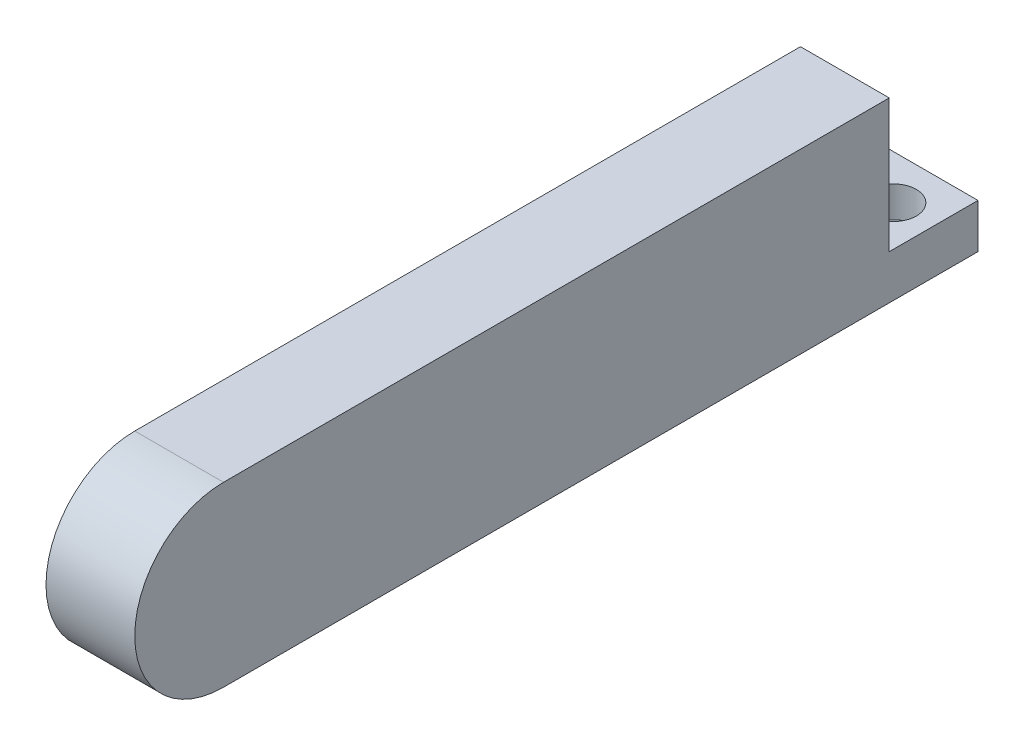
from build123d import *

# Parameters (mm, degrees)
SKETCH_4_R          = 11
EXTRUDE_2_DEPTH     = 20
SKETCH_20_W         = 20
SKETCH_20_H         = 20
EXTRUDE_4_DEPTH     = 10
SKETCH_22_W         = 20
SKETCH_22_H         = 95
EXTRUDE_6_DEPTH     = 10
SKETCH_23_R         = 5.2
CUT_EXTRUDE_1_DEPTH = 7
SKETCH_24_R         = 5.2
CUT_EXTRUDE_2_DEPTH = 7
SKETCH_25_R         = 5.2
CUT_EXTRUDE_3_DEPTH = 7
SKETCH_26_R         = 3.15
CUT_EXTRUDE_4_DEPTH = 3
SKETCH_27_R         = 3.15
CUT_EXTRUDE_5_DEPTH = 3
SKETCH_28_R         = 3.15
CUT_EXTRUDE_6_DEPTH = 3
EXTRUDE_START       = -13
SKETCH_17_R         = 11
EXTRUDE_7_DEPTH     = 13


with BuildPart() as part:
    # Эскиз4 → Бобышка-Вытянуть2 (new body)
    with BuildSketch(Plane(origin=(0, 0, 0), x_dir=(0, 0, -1), z_dir=(1, 0, 0))):
        with BuildLine():
            Line((0, 40), (-150, 40))
            ThreePointArc((-150, 40), (-170, 20), (-150, 0))
            Line((-150, 0), (0, 0))
            Line((0, 0), (0, 40))
        make_face()
        with Locations((-150, 20)):
            Circle(SKETCH_4_R, mode=Mode.SUBTRACT)
    extrude(amount=EXTRUDE_2_DEPTH)

    # Эскиз20 → Бобышка-Вытянуть4 (add)
    with BuildSketch(Plane.XZ):
        with Locations((10, -10)):
            Rectangle(SKETCH_20_W, SKETCH_20_H)
    extrude(amount=-EXTRUDE_4_DEPTH)

    # Эскиз22 → Бобышка-Вытянуть6 (add)
    with BuildSketch(Plane.XZ):
        with Locations((-10, 27.5)):
            Rectangle(SKETCH_22_W, SKETCH_22_H)
    extrude(amount=-EXTRUDE_6_DEPTH)

    # Эскиз23 → Вырез-Вытянуть1 (cut)
    with BuildSketch(Plane(origin=(0, 10, 0), x_dir=(1, 0, 0), z_dir=(0, 1, 0))):
        with Locations((-10, -59.028911245)):
            Circle(SKETCH_23_R)
    extrude(amount=-CUT_EXTRUDE_1_DEPTH, mode=Mode.SUBTRACT)

    # Эскиз24 → Вырез-Вытянуть2 (cut)
    with BuildSketch(Plane(origin=(0, 10, 0), x_dir=(1, 0, 0), z_dir=(0, 1, 0))):
        with Locations((-10, -17.707033433)):
            Circle(SKETCH_24_R)
    extrude(amount=-CUT_EXTRUDE_2_DEPTH, mode=Mode.SUBTRACT)

    # Эскиз25 → Вырез-Вытянуть3 (cut)
    with BuildSketch(Plane(origin=(0, 10, 0), x_dir=(1, 0, 0), z_dir=(0, 1, 0))):
        with Locations((10.900977194, 10)):
            Circle(SKETCH_25_R)
    extrude(amount=-CUT_EXTRUDE_3_DEPTH, mode=Mode.SUBTRACT)

    # Эскиз26 → Вырез-Вытянуть4 (cut)
    with BuildSketch(Plane(origin=(0, 3, 0), x_dir=(1, 0, 0), z_dir=(0, 1, 0))):
        with Locations((-10, -17.707033433)):
            Circle(SKETCH_26_R)
    extrude(amount=-CUT_EXTRUDE_4_DEPTH, mode=Mode.SUBTRACT)

    # Эскиз27 → Вырез-Вытянуть5 (cut)
    with BuildSketch(Plane(origin=(0, 3, 0), x_dir=(1, 0, 0), z_dir=(0, 1, 0))):
        with Locations((-10, -59.028911245)):
            Circle(SKETCH_27_R)
    extrude(amount=-CUT_EXTRUDE_5_DEPTH, mode=Mode.SUBTRACT)

    # Эскиз28 → Вырез-Вытянуть6 (cut)
    with BuildSketch(Plane(origin=(0, 3, 0), x_dir=(1, 0, 0), z_dir=(0, 1, 0))):
        with Locations((10.900977194, 10)):
            Circle(SKETCH_28_R)
    extrude(amount=-CUT_EXTRUDE_6_DEPTH, mode=Mode.SUBTRACT)

    # Эскиз17 → Бобышка-Вытянуть7 (add)
    with BuildSketch(Plane(origin=(20, 0, 0), x_dir=(0, 0, -1), z_dir=(1, 0, 0)).offset(EXTRUDE_START)):
        with Locations((-150, 20)):
            Circle(SKETCH_17_R)
    extrude(amount=EXTRUDE_7_DEPTH)


solid = part.part
